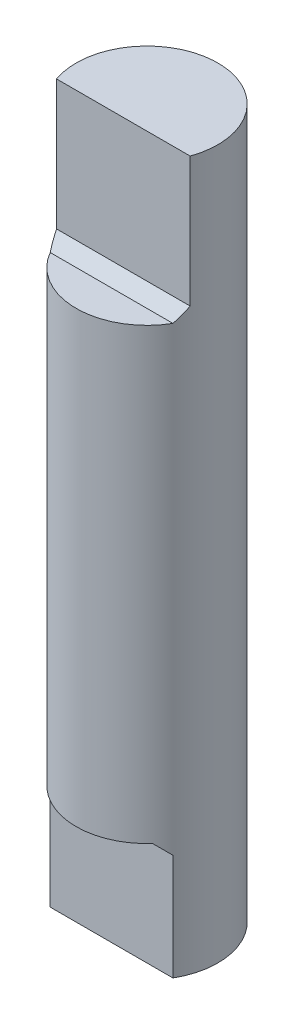
from build123d import *

# Parameters (mm, degrees)
CROQUIS1_R                 = 3
SALIENTE_EXTRUIR1_DEPTH    = 15
CORTAR_EXTRUIR2_DEPTH      = 31.298514815
CORTAR_EXTRUIR2_DEPTH_BACK = 6
CROQUIS3_W                 = 8.224241852
CROQUIS3_H                 = 2
CHAFL_N1_SIZE              = 0.5
CORTAR_EXTRUIR3_START      = -5
CORTAR_EXTRUIR3_DEPTH      = 5
CHAFL_N2_SIZE              = 0.5


with BuildPart() as part:
    # Croquis1 → Saliente-Extruir1 (new, symmetric)
    with BuildSketch(Plane(origin=(0, 0, 0), x_dir=(1, 0, 0), z_dir=(0, 1, 0))):
        Circle(CROQUIS1_R)
    extrude(amount=SALIENTE_EXTRUIR1_DEPTH, both=True)

    # Croquis3 → Cortar-Extruir2 (cut, two sides: drawn at the far end of the back side and taken through both)
    with BuildSketch(Plane(origin=(0, 15, 0), x_dir=(1, 0, 0), z_dir=(0, 1, 0)).offset(-CORTAR_EXTRUIR2_DEPTH_BACK)):
        with Locations((0.237694851, -2)):
            Rectangle(CROQUIS3_W, CROQUIS3_H)
    extrude(amount=CORTAR_EXTRUIR2_DEPTH + CORTAR_EXTRUIR2_DEPTH_BACK, mode=Mode.SUBTRACT)

    # Chaflán1
    chafl_n1_edges = [part.edges().sort_by_distance(p)[0] for p in [
        (0, 9, 1),
    ]]
    chamfer(chafl_n1_edges, length=CHAFL_N1_SIZE)

    # Croquis7 → Cortar-Extruir3 (cut)
    with BuildSketch(Plane.XZ.offset(15).offset(CORTAR_EXTRUIR3_START)):
        with BuildLine():
            Line((-2.598076211, 1.5), (2.598076211, 1.5))
            ThreePointArc((2.598076211, 1.5), (0, 3), (-2.598076211, 1.5))
        make_face()
    extrude(amount=CORTAR_EXTRUIR3_DEPTH, mode=Mode.SUBTRACT)

    # Chaflán2
    chafl_n2_edges = [part.edges().sort_by_distance(p)[0] for p in [
        (0, -10, 1.5),
    ]]
    chamfer(chafl_n2_edges, length=CHAFL_N2_SIZE)


solid = part.part
